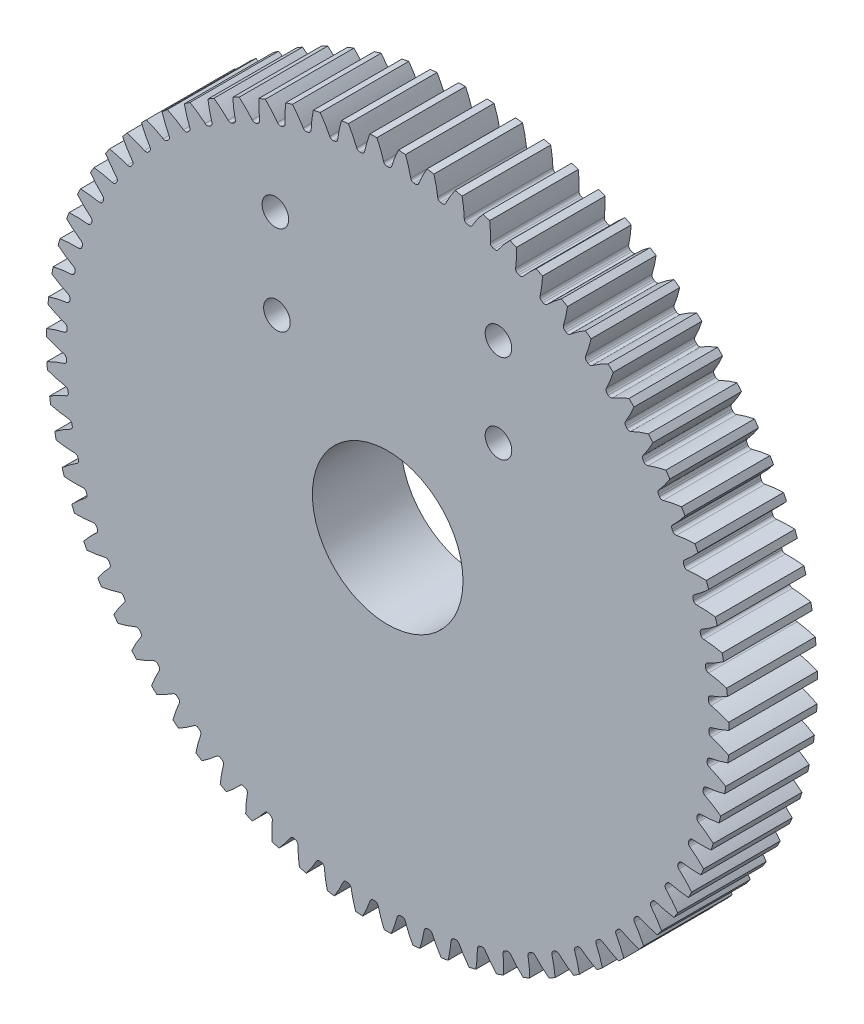
from build123d import *

# Parameters (mm, degrees)
SKETCH_1_R               = 38.5
LASHENA_DEPTH            = 10
CUT_EXTRUDEA_DEPTH       = 30
PATTERN_CIRCULAR_1_COUNT = 75
SKETCH_3_R               = 8.5
SKETCH_3_R_2             = 1.5
CUT_EXTRUDE_2_DEPTH      = 10
SKETCH_4_R               = 1.5
CUT_EXTRUDE_3_DEPTH      = 10


with BuildPart() as part:
    # 草图1 → LaShenA (new body)
    with BuildSketch(Plane.XY):
        Circle(SKETCH_1_R)
    extrude(amount=LASHENA_DEPTH)

    # SketchA → Cut-ExtrudeA (cut)
    with BuildSketch(Plane.XY.offset(10)):
        with BuildLine():
            ThreePointArc((0.091577355, 36.249884325), (0, 36.25), (-0.091577355, 36.249884325))
            ThreePointArc((-0.091577355, 36.249884325), (-0.320511841, 36.325863991), (-0.457587272, 36.524343801))
            add(Edge.make_bspline(
                [(-0.457587272, 36.524343801), (-0.460821953, 36.535532241), (-0.470382685, 36.568511471), (-0.486602543, 36.623768686), (-0.50675522, 36.690545595), (-0.527851198, 36.758788572), (-0.549927552, 36.828482717), (-0.573000874, 36.899619056), (-0.597093316, 36.972186691), (-0.622225365, 37.046174975), (-0.64841784, 37.121572911), (-0.67569134, 37.198369321), (-0.704066389, 37.276552799), (-0.733563399, 37.356111725), (-0.764202674, 37.437034264), (-0.796004408, 37.519308366), (-0.828988683, 37.602921767), (-0.863175466, 37.687861991), (-0.898584606, 37.77411635), (-0.935235836, 37.861671946), (-0.973148769, 37.950515671), (-1.012342893, 38.040634209), (-1.052837575, 38.132014036), (-1.094652053, 38.224641422), (-1.137805439, 38.318502432), (-1.182316714, 38.413582926), (-1.228204727, 38.509868562), (-1.275488195, 38.607344795), (-1.324185695, 38.705996882), (-1.391527659, 38.840080374), (-1.443465088, 38.940858442), (-1.478804602, 39.008300624)],
                knots=[0.096665642, 0.096665642, 0.096665642, 0.096665642, 0.108397743, 0.131255784, 0.154677173, 0.178661909, 0.203209993, 0.228321424, 0.253996203, 0.280234329, 0.307035802, 0.334400623, 0.362328792, 0.390820307, 0.41987517, 0.449493381, 0.479674939, 0.510419844, 0.541728097, 0.573599698, 0.606034645, 0.63903294, 0.672594583, 0.706719573, 0.74140791, 0.776659595, 0.812474627, 0.848853007, 0.885794734, 0.923299809, 1, 1, 1, 1], degree=3))
            ThreePointArc((-1.478804602, 39.008300624), (0, 39.0363213), (1.478804602, 39.008300624))
            add(Edge.make_bspline(
                [(0.457587272, 36.524343801), (0.460821953, 36.535532241), (0.470382685, 36.568511471), (0.486602543, 36.623768686), (0.50675522, 36.690545595), (0.527851198, 36.758788572), (0.549927552, 36.828482717), (0.573000874, 36.899619056), (0.597093316, 36.972186691), (0.622225365, 37.046174975), (0.64841784, 37.121572911), (0.67569134, 37.198369321), (0.704066389, 37.276552799), (0.733563399, 37.356111725), (0.764202674, 37.437034264), (0.796004408, 37.519308366), (0.828988683, 37.602921767), (0.863175466, 37.687861991), (0.898584606, 37.77411635), (0.935235836, 37.861671946), (0.973148769, 37.950515671), (1.012342893, 38.040634209), (1.052837575, 38.132014036), (1.094652053, 38.224641422), (1.137805439, 38.318502432), (1.182316714, 38.413582926), (1.228204727, 38.509868562), (1.275488195, 38.607344795), (1.324185695, 38.705996882), (1.391527659, 38.840080374), (1.443465088, 38.940858442), (1.478804602, 39.008300624)],
                knots=[0.096665642, 0.096665642, 0.096665642, 0.096665642, 0.108397743, 0.131255784, 0.154677173, 0.178661909, 0.203209993, 0.228321424, 0.253996203, 0.280234329, 0.307035802, 0.334400623, 0.362328792, 0.390820307, 0.41987517, 0.449493381, 0.479674939, 0.510419844, 0.541728097, 0.573599698, 0.606034645, 0.63903294, 0.672594583, 0.706719573, 0.74140791, 0.776659595, 0.812474627, 0.848853007, 0.885794734, 0.923299809, 1, 1, 1, 1], degree=3))
            ThreePointArc((0.457587272, 36.524343801), (0.320511841, 36.325863991), (0.091577355, 36.249884325))
        make_face()
    cut_extrudea = extrude(amount=-CUT_EXTRUDEA_DEPTH, mode=Mode.SUBTRACT)

    # 阵列(圆周)1: Cut-ExtrudeA ×75 about axis
    pattern_circular_1_axis = Axis((0, 0, -80.9), (0, 0, 1))
    for i in range(1, PATTERN_CIRCULAR_1_COUNT):
        add(cut_extrudea.rotate(pattern_circular_1_axis, i * 360 / PATTERN_CIRCULAR_1_COUNT), mode=Mode.SUBTRACT)

    # 草图3 → 切除-拉伸2 (cut)
    with BuildSketch(Plane.XY.offset(10)):
        Circle(SKETCH_3_R)
        with Locations((-12.5, 15.5)):
            Circle(SKETCH_3_R_2)
        with Locations((12.5, 15.5)):
            Circle(SKETCH_3_R_2)
    extrude(amount=-CUT_EXTRUDE_2_DEPTH, mode=Mode.SUBTRACT)

    # 草图4 → 切除-拉伸3 (cut)
    with BuildSketch(Plane(origin=(0, 0, 0), x_dir=(-1, 0, 0), z_dir=(0, 0, -1))):
        with Locations((-12.5, 25.5)):
            Circle(SKETCH_4_R)
        with Locations((12.672894534, 25.5)):
            Circle(SKETCH_4_R)
    extrude(amount=-CUT_EXTRUDE_3_DEPTH, mode=Mode.SUBTRACT)


solid = part.part
